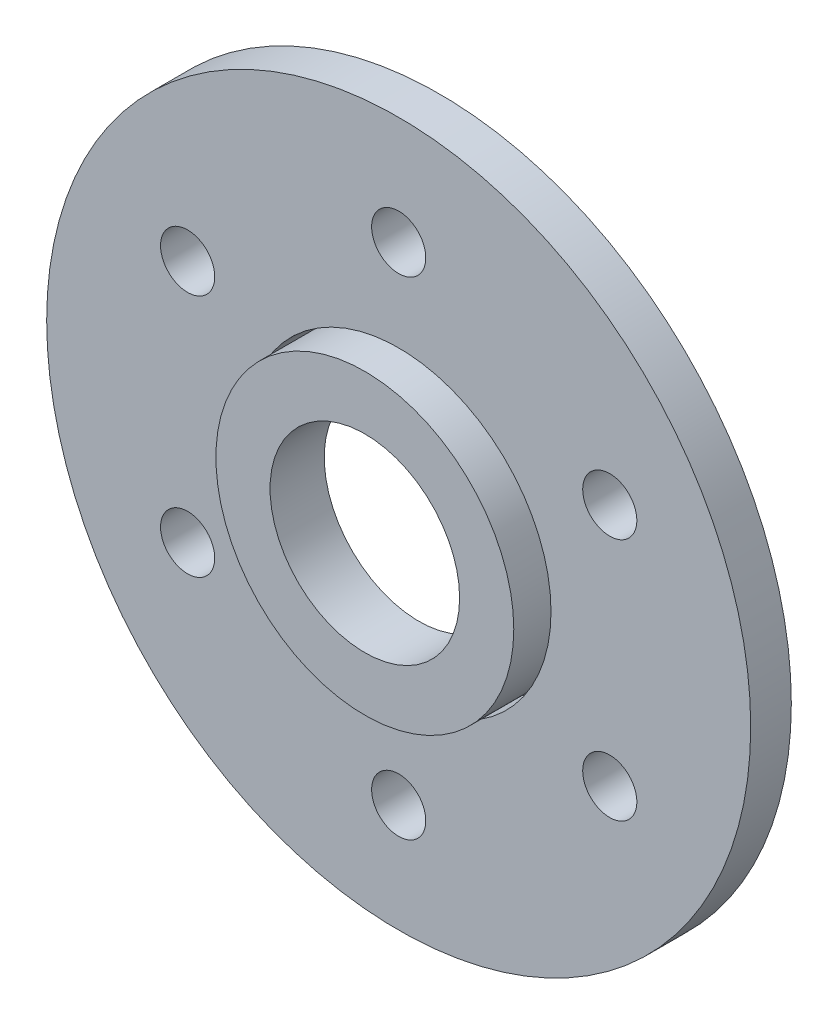
from build123d import *

# Parameters (mm, degrees)
CROQUIS1_R              = 11
CROQUIS1_R_2            = 7
SALIENTE_EXTRUIR1_DEPTH = 4
CROQUIS2_R              = 26
CROQUIS2_R_2            = 11.25
SALIENTE_EXTRUIR2_DEPTH = 1.5
CROQUIS3_R              = 2
CORTAR_EXTRUIR1_DEPTH   = 38.17862289


with BuildPart() as part:
    # Croquis1 → Saliente-Extruir1 (new body)
    with BuildSketch(Plane.XY):
        Circle(CROQUIS1_R)
        Circle(CROQUIS1_R_2, mode=Mode.SUBTRACT)
    extrude(amount=SALIENTE_EXTRUIR1_DEPTH)


with BuildPart() as body_2:
    # Croquis2 → Saliente-Extruir2 (new, symmetric)
    with BuildSketch(Plane(origin=(0, 0, 0), x_dir=(-1, 0, 0), z_dir=(0, 0, -1))):
        Circle(CROQUIS2_R)
        Circle(CROQUIS2_R_2, mode=Mode.SUBTRACT)
    extrude(amount=SALIENTE_EXTRUIR2_DEPTH, both=True)

    # Croquis3 → Cortar-Extruir1 (cut, through all)
    with BuildSketch(Plane(origin=(0, 0, -1.5), x_dir=(-1, 0, 0), z_dir=(0, 0, -1))):
        with Locations((0, 18)):
            Circle(CROQUIS3_R)
        with Locations((15.588457268, 9)):
            Circle(CROQUIS3_R)
        with Locations((15.588457268, -9)):
            Circle(CROQUIS3_R)
        with Locations((0, -18)):
            Circle(CROQUIS3_R)
        with Locations((-15.588457268, -9)):
            Circle(CROQUIS3_R)
        with Locations((-15.588457268, 9)):
            Circle(CROQUIS3_R)
    extrude(amount=-CORTAR_EXTRUIR1_DEPTH, mode=Mode.SUBTRACT)


solid = Compound([part.part, body_2.part])
